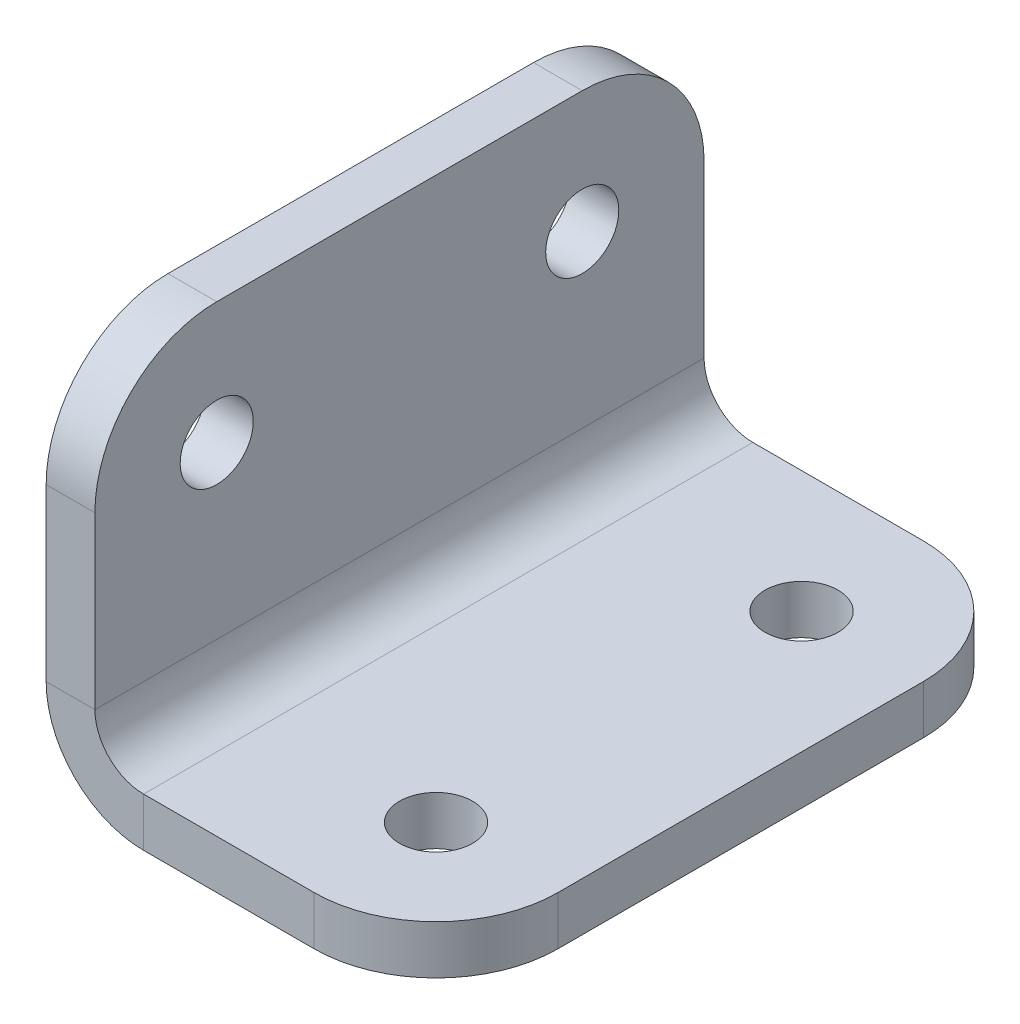
from build123d import *

# Parameters (mm, degrees)
SM_BASE_FLANGE_1_DEPTH = 25
SKETCH_6_R             = 1.5
CUT_EXTRUDE_1_DEPTH    = 37.728735344
SKETCH_7_R             = 1.5
CUT_EXTRUDE_2_DEPTH    = 35.942810419


# Sheet-metal steps are written as plain solids
with BuildPart() as part:
    # Sketch 1 → 基体-法兰1 (new body)
    with BuildSketch(Plane.XY):
        with BuildLine():
            Line((0, 20), (0, 4))
            ThreePointArc((0, 4), (1.171572875, 1.171572875), (4, 0))
            Line((4, 0), (20, 0))
            Line((20, 0), (20, 2))
            Line((20, 2), (4, 2))
            ThreePointArc((4, 2), (2.585786438, 2.585786438), (2, 4))
            Line((2, 4), (2, 20))
            Line((2, 20), (0, 20))
        make_face()
    extrude(amount=SM_BASE_FLANGE_1_DEPTH)

    # 草图6 → 切除-拉伸1 (cut, through all)
    with BuildSketch(Plane(origin=(0, 2, 0), x_dir=(1, 0, 0), z_dir=(0, 1, 0))):
        with Locations(Location((11, -5, 0), (0, 0, 270))):
            Circle(SKETCH_6_R)
        with Locations(Location((11, -20, 0), (0, 0, 90))):
            Circle(SKETCH_6_R)
        with BuildLine():
            Line((11, 0), (33.790991845, 0))
            Line((33.790991845, 0), (33.790991845, -25))
            Line((33.790991845, -25), (11, -25))
            ThreePointArc((11, -25), (14.535533906, -23.535533906), (16, -20))
            Line((16, -20), (16, -5))
            ThreePointArc((16, -5), (14.535533906, -1.464466094), (11, 0))
        make_face()
    extrude(amount=-CUT_EXTRUDE_1_DEPTH, mode=Mode.SUBTRACT)

    # 草图7 → 切除-拉伸2 (cut, through all)
    with BuildSketch(Plane(origin=(2, 0, 0), x_dir=(0, 0, -1), z_dir=(1, 0, 0))):
        with Locations(Location((-20, 11, 0), (0, 0, 90))):
            Circle(SKETCH_7_R)
        with Locations(Location((-5, 11, 0), (0, 0, 270))):
            Circle(SKETCH_7_R)
        with BuildLine():
            Line((-25, 11), (-25, 23.177465953))
            Line((-25, 23.177465953), (0, 23.177465953))
            Line((0, 23.177465953), (0, 11))
            ThreePointArc((0, 11), (-1.464466094, 14.535533906), (-5, 16))
            Line((-5, 16), (-20, 16))
            ThreePointArc((-20, 16), (-23.535533906, 14.535533906), (-25, 11))
        make_face()
    extrude(amount=-CUT_EXTRUDE_2_DEPTH, mode=Mode.SUBTRACT)


solid = part.part
